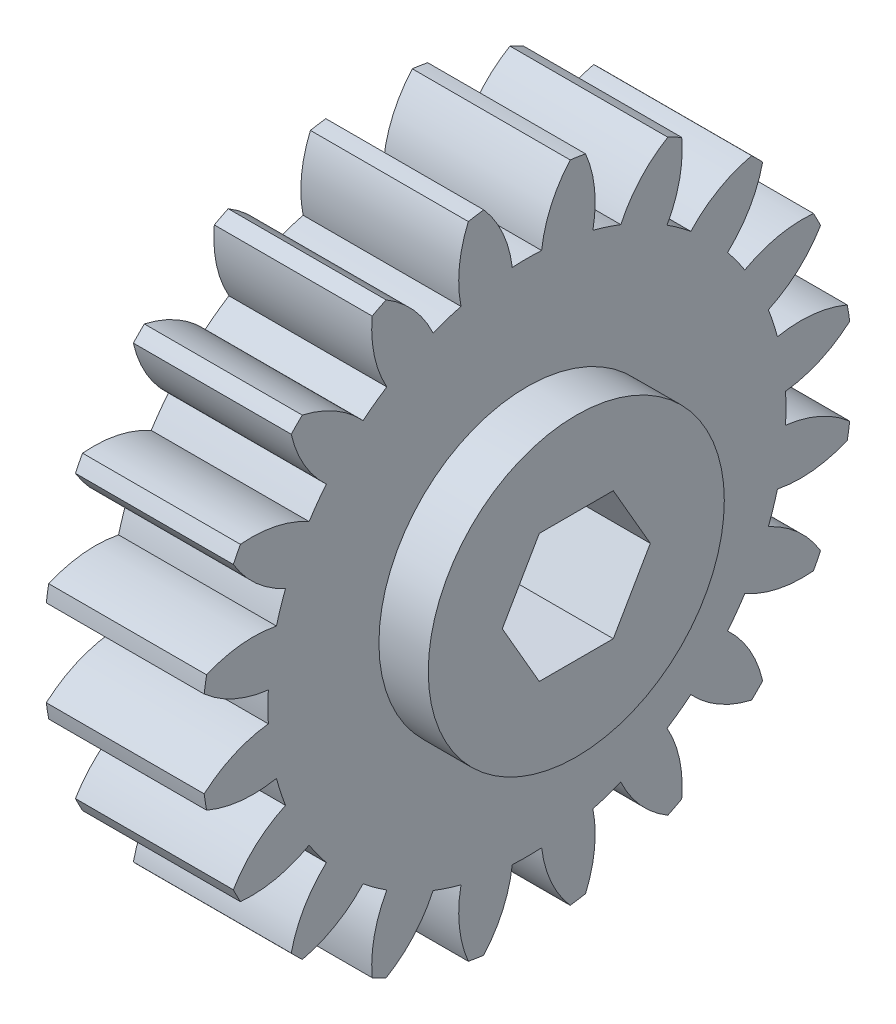
from build123d import *

# Parameters (mm, degrees)
BASPROSKE_W         = 8
BASPROSKE_H         = 16.5
TOOTHCUT_DEPTH      = 25.667792767
TEETHCUTS_COUNT     = 20
TEETHCUTS_ANGLE     = 342
BORSKE_R            = 2.5
BORE_DEPTH          = 50.0000508
CUT_EXTRUDE1_DEPTH  = 25.472631648
SKETCH2_R           = 7.5
BOSS_EXTRUDE1_DEPTH = 2.5
BOSS_EXTRUDE2_START = 2.5
SKETCH3_R           = 7.5
BOSS_EXTRUDE2_DEPTH = 2.5


with BuildPart() as part:
    # BasProSke → Base-Revolve (revolve)
    with BuildSketch(Plane(origin=(0, 0, 0), x_dir=(1, 0, 0), z_dir=(0, 1, 0))):
        with Locations((4, 8.25)):
            Rectangle(BASPROSKE_W, BASPROSKE_H)
    revolve(axis=Axis((-10, 0, 0), (1, 0, 0)))

    # TooCutSke → ToothCut (cut, through all)
    with BuildSketch(Plane(origin=(0, 0, 0), x_dir=(0, 0, -1), z_dir=(1, 0, 0))):
        with BuildLine():
            ThreePointArc((0.74381438, 13.102904875), (0, 13.124), (-0.74381438, 13.102904875))
            ThreePointArc((-0.74381438, 13.102904875), (-1.226473103, 14.852072512), (-2.209965745, 16.376962373))
            ThreePointArc((-2.209965745, 16.376962373), (0, 16.5254), (2.209965745, 16.376962373))
            ThreePointArc((2.209965745, 16.376962373), (1.226473103, 14.852072512), (0.74381438, 13.102904875))
        make_face()
    toothcut = extrude(amount=TOOTHCUT_DEPTH, mode=Mode.SUBTRACT)

    # TeethCuts: ToothCut ×20 about axis
    teethcuts_axis = Axis((-10, 0, 0), (1, 0, 0))
    for i in range(1, TEETHCUTS_COUNT):
        add(toothcut.rotate(teethcuts_axis, i * TEETHCUTS_ANGLE / (TEETHCUTS_COUNT - 1)), mode=Mode.SUBTRACT)

    # BorSke → Bore (cut, symmetric)
    with BuildSketch(Plane(origin=(0, 0, 0), x_dir=(0, 0, -1), z_dir=(1, 0, 0))):
        Circle(BORSKE_R)
    extrude(amount=BORE_DEPTH, both=True, mode=Mode.SUBTRACT)

    # Sketch1 → Cut-Extrude1 (cut, through all)
    with BuildSketch(Plane(origin=(8, 0, 0), x_dir=(0, 0, -1), z_dir=(1, 0, 0))):
        Polygon((3.75, 0), (1.875, 3.247595264), (-1.875, 3.247595264), (-3.75, 0), (-1.875, -3.247595264), (1.875, -3.247595264), align=None)
    extrude(amount=-CUT_EXTRUDE1_DEPTH, mode=Mode.SUBTRACT)

    # Sketch2 → Boss-Extrude1 (add)
    with BuildSketch(Plane(origin=(8, 16.230303067, -2.971070911), x_dir=(0, 0, -1), z_dir=(1, 0, 0))):
        with Locations((-2.971070911, -16.230303067)):
            Circle(SKETCH2_R)
        Polygon((-4.846070911, -12.982707803), (-6.721070911, -16.230303067), (-4.846070911, -19.477898331), (-1.096070911, -19.477898331), (0.778929089, -16.230303067), (-1.096070911, -12.982707803), align=None, mode=Mode.SUBTRACT)
    extrude(amount=BOSS_EXTRUDE1_DEPTH)

    # Sketch3 → Boss-Extrude2 (add)
    with BuildSketch(Plane.ZY.offset(BOSS_EXTRUDE2_START)):
        Circle(SKETCH3_R)
        Polygon((3.75, 0), (1.875, -3.247595264), (-1.875, -3.247595264), (-3.75, 0), (-1.875, 3.247595264), (1.875, 3.247595264), align=None, mode=Mode.SUBTRACT)
    extrude(amount=-BOSS_EXTRUDE2_DEPTH)


solid = part.part
